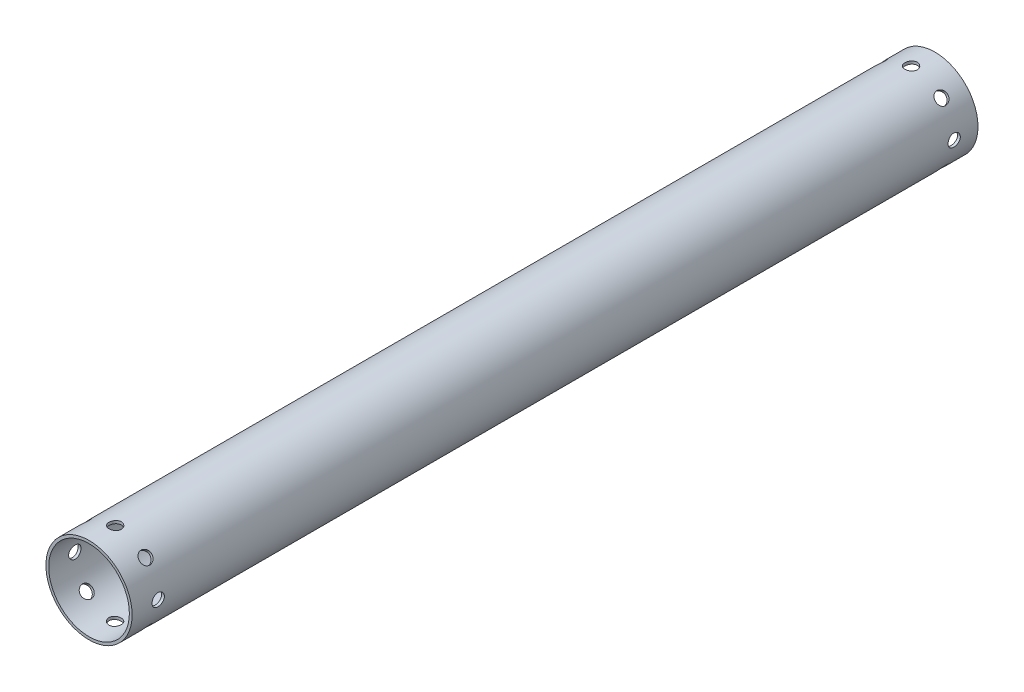
from build123d import *

# Parameters (mm, degrees)
CROQUIS1_R              = 28.0509
CROQUIS1_R_2            = 26.2509
SALIENTE_EXTRUIR1_DEPTH = 550.5
MATRIZC1_COUNT          = 8


with BuildPart() as part:
    # Croquis1 → Saliente-Extruir1 (new body)
    with BuildSketch(Plane.XY):
        Circle(CROQUIS1_R)
        Circle(CROQUIS1_R_2, mode=Mode.SUBTRACT)
    extrude(amount=-SALIENTE_EXTRUIR1_DEPTH)

    # Croquis13 → Ø8.0mm Dowel Hole1 (revolve, cut)
    with BuildSketch(Plane(origin=(0, 28.0509, -535), x_dir=(0, 0, 1), z_dir=(1, 0, 0))):
        Polygon((0, 0), (0, 9.403442476), (4, 7), (4, 0), align=None)
    f_8_0mm_dowel_hole1 = revolve(axis=Axis((0, 34.4009, -535), (0, -1, 0)), mode=Mode.SUBTRACT)

    # Croquis17 → Ø8.0mm Dowel Hole2 (revolve, cut)
    with BuildSketch(Plane(origin=(0, 28.0509, -17), x_dir=(0, 0, 1), z_dir=(1, 0, 0))):
        Polygon((0, 0), (0, 9.403442476), (4, 7), (4, 0), align=None)
    f_8_0mm_dowel_hole2 = revolve(axis=Axis((0, 34.4009, -17), (0, -1, 0)), mode=Mode.SUBTRACT)

    # MatrizC1: Ø8.0mm Dowel Hole1, Ø8.0mm Dowel Hole2 ×8 about axis
    matrizc1_axis = Axis((0, 0, -550.5), (0, 0, 1))
    add([f_8_0mm_dowel_hole1.rotate(matrizc1_axis, i * 360 / MATRIZC1_COUNT) for i in range(1, MATRIZC1_COUNT)], mode=Mode.SUBTRACT)
    add([f_8_0mm_dowel_hole2.rotate(matrizc1_axis, i * 360 / MATRIZC1_COUNT) for i in range(1, MATRIZC1_COUNT)], mode=Mode.SUBTRACT)


solid = part.part
